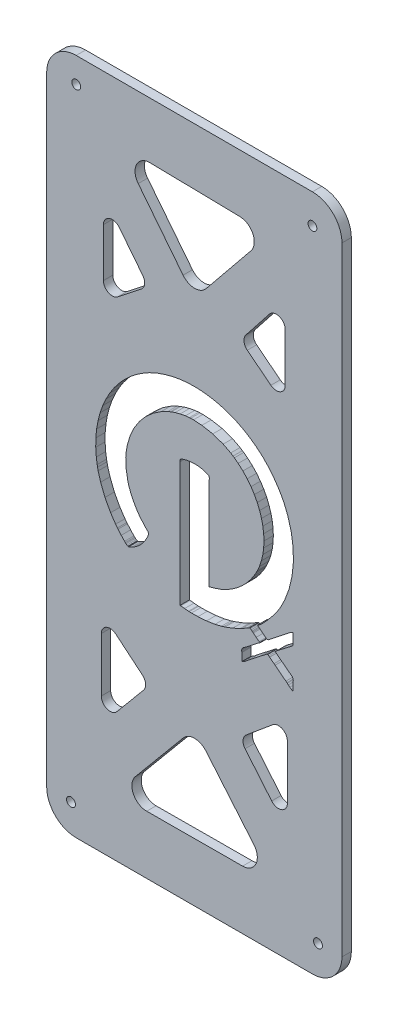
from build123d import *

# Parameters (mm, degrees)
SKETCH1_R            = 1.5
BOSS_EXTRUDE1_DEPTH  = 3.175
FILLET1_R            = 10
CUT_EXTRUDE1_DEPTH   = 10
CUT_EXTRUDE2_DEPTH   = 422.202335286
FILLET2_R            = 5
CUT_EXTRUDE3_DEPTH   = 10
FILLET3_R            = 3
FILLET3_OF_MIRROR1_R = 3


with BuildPart() as part:
    # Sketch1 → Boss-Extrude1 (new body)
    with BuildSketch(Plane.XY):
        Polygon((265, -210.189762894), (365, -210.108681785), (365, 19.292893219), (265, 19.292893219), align=None)
        with Locations((273.244250911, -200.546907154)):
            Circle(SKETCH1_R, mode=Mode.SUBTRACT)
        with Locations((356.893580541, -200.189762894)):
            Circle(SKETCH1_R, mode=Mode.SUBTRACT)
        with Locations((355, 9.292893219)):
            Circle(SKETCH1_R, mode=Mode.SUBTRACT)
        with Locations((275, 10.782163294)):
            Circle(SKETCH1_R, mode=Mode.SUBTRACT)
    extrude(amount=BOSS_EXTRUDE1_DEPTH)

    # Fillet1
    fillet1_edges = [part.edges().sort_by_distance(p)[0] for p in [
        (365, -210.108681785, 1.5875),
        (265, -210.189762894, 1.5875),
        (265, 19.292893219, 1.5875),
        (365, 19.292893219, 1.5875),
    ]]
    fillet(fillet1_edges, radius=FILLET1_R)

    # Sketch4 → Cut-Extrude1 (cut)
    with BuildSketch(Plane.XY.offset(3.175)):
        Polygon((320.437053308, -113.928378238), (320.057005808, -114.057638838), (320.057005808, -82.630688738), (320.075319208, -82.250641238), (320.049716008, -81.827566138), (320.027579908, -81.751378838), (320.014067108, -81.703106138), (319.931567908, -81.570022838), (319.780171208, -81.439784338), (319.598281808, -81.343327838), (319.456041808, -81.282075738), (319.408747008, -81.261806538), (319.281442208, -81.206421838), (317.969100408, -80.769833938), (317.834505808, -80.734629538), (317.492952008, -80.644484938), (316.442065108, -80.475219338), (315.008108108, -80.404188238), (313.575217908, -80.509445838), (312.528064808, -80.690801838), (312.185622008, -80.778546138), (312.069429708, -80.807972038), (311.718274708, -80.894293938), (311.186297108, -81.046757438), (310.681789608, -81.251671938), (310.376062508, -81.441206738), (310.296941508, -81.525572838), (310.260759208, -81.564244338), (310.187416708, -81.713774138), (310.145900408, -81.935135138), (310.143055608, -82.167608638), (310.148389608, -82.332073638), (310.148389608, -124.429335138), (310.411711408, -124.431290938), (311.722630808, -124.560996038), (313.033994708, -124.698968838), (313.296872008, -124.705636338), (314.029585808, -124.723594138), (316.229327408, -124.693190338), (319.143558308, -124.484275338), (322.028718908, -124.039153038), (324.173075808, -123.532689738), (324.872452108, -123.315595938), (325.402029408, -123.150775338), (327.984307708, -122.188966238), (330.491910008, -121.047756938), (330.984327108, -120.793680738), (331.142480208, -120.712248338), (332.684895208, -119.817025338), (332.836380808, -119.723947038), (332.896655008, -119.686786838), (333.233319308, -119.452802038), (333.596475808, -119.284958838), (333.669818308, -119.281136138), (333.743694208, -119.276868938), (333.969855808, -119.347188838), (334.265981708, -119.530411738), (334.542282908, -119.760129338), (334.719371708, -119.916326638), (334.781068308, -119.965043838), (334.972558908, -120.114573638), (335.945391608, -120.916184938), (336.971208708, -121.635297038), (337.188747008, -121.743843938), (337.188747008, -121.929022638), (337.073088108, -121.977828738), (336.742202308, -122.166296738), (336.321171908, -122.464378438), (335.917388108, -122.790819238), (335.622240108, -123.034494138), (335.521872008, -123.113615138), (332.651202108, -125.355406438), (332.557057008, -125.429193438), (332.259064208, -125.631174238), (331.809585808, -125.941346338), (331.401001408, -126.286278338), (331.176262208, -126.562579538), (331.132879008, -126.667748238), (331.106297908, -126.732823038), (331.065315008, -126.945560738), (331.052780108, -127.253777038), (331.066292908, -127.565816038), (331.076872008, -127.782820938), (331.076872008, -130.448576338), (331.274674508, -130.397014338), (332.201634808, -129.818275338), (333.049118508, -129.092406838), (333.206827108, -128.967413438), (333.559315608, -128.687645138), (337.113093108, -125.929789338), (337.466559508, -125.652421338), (337.597864808, -125.549208438), (338.908784208, -124.519479738), (339.040889608, -124.418222638), (339.082850408, -124.386396438), (339.203843308, -124.286117238), (339.383776908, -124.149033438), (339.577756708, -124.043509138), (339.731553708, -124.004926538), (339.781693308, -124.007326838), (339.850679708, -124.010616138), (340.179165208, -124.173214238), (340.471912908, -124.408621438), (340.522497008, -124.448626438), (342.004193308, -125.600859338), (342.368327708, -125.882583438), (345.992958508, -128.717515538), (346.356559508, -128.999328538), (346.482530808, -129.096229538), (346.845687308, -129.405868238), (347.362640808, -129.837033238), (347.909109108, -130.211302238), (348.336984808, -130.412927438), (348.486514608, -130.448576338), (348.486514608, -127.874476838), (348.496649208, -127.653115838), (348.508739608, -127.340098938), (348.495582408, -127.030015738), (348.456110808, -126.812921938), (348.430596508, -126.745891338), (348.387124408, -126.630588038), (348.152250608, -126.324860938), (347.722596908, -125.949169538), (347.244137108, -125.614905538), (346.921874608, -125.395855938), (346.819639608, -125.316379338), (346.580409708, -125.129689338), (344.188999708, -123.258344338), (343.948880808, -123.072632238), (343.822109408, -122.974219938), (343.186296608, -122.462956038), (342.518302008, -122.002365138), (342.374639608, -121.929022638), (342.448426608, -121.832566138), (342.701169308, -121.567733038), (343.072949108, -121.246626238), (343.466064908, -120.947033238), (343.760323908, -120.727183538), (343.856247008, -120.651796338), (344.102233308, -120.458972238), (346.573653308, -118.548511238), (346.819639608, -118.356487238), (346.918496408, -118.279322038), (347.227690608, -118.066673238), (347.678146908, -117.752678438), (348.091976408, -117.405879538), (348.335473508, -117.124244338), (348.391391608, -117.017653238), (348.425262508, -116.953467438), (348.481180608, -116.739396238), (348.505717008, -116.428690738), (348.496649208, -116.112829038), (348.486514608, -115.891023538), (348.486514608, -113.224201338), (348.337962708, -113.246426338), (347.908131208, -113.426804438), (347.355973308, -113.792805738), (346.836530608, -114.226904438), (346.480041608, -114.535654138), (346.356559508, -114.633088538), (345.994292008, -114.918101938), (342.365482908, -117.770013938), (342.004193308, -118.057961038), (341.874399308, -118.161173938), (340.561524108, -119.180768038), (340.429952108, -119.282558538), (340.388969208, -119.314384738), (340.267887408, -119.414219438), (340.089376208, -119.547391638), (339.896552108, -119.641981238), (339.739199108, -119.668028938), (339.689059508, -119.660205738), (339.618739608, -119.649093238), (339.416136508, -119.556014938), (339.149436508, -119.367458038), (338.897671708, -119.148408438), (338.729739608, -118.999856538), (338.670443308, -118.954606438), (338.476107908, -118.804543238), (336.541021608, -117.274752038), (336.355309508, -117.113576338), (336.579159708, -116.997917438), (337.202704308, -116.560440538), (338.000937408, -115.858663938), (338.744763708, -115.089234438), (339.256916608, -114.523563738), (339.427249008, -114.335451338), (339.804451708, -113.918777038), (341.594719908, -111.788377438), (343.227279508, -109.535029138), (343.524916708, -109.057013838), (344.098410608, -108.136809938), (345.570950208, -105.223112438), (347.093096008, -101.169805838), (348.086642408, -96.962079938), (348.546255408, -92.666076338), (348.467223308, -88.346514238), (347.843589808, -84.069357438), (346.671087708, -79.900214138), (345.441689608, -76.869435338), (344.943405108, -75.904781438), (344.602918108, -75.243898838), (343.466064908, -73.320991838), (341.765407908, -70.867440738), (339.854057908, -68.575065338), (338.295729808, -66.973265138), (337.744372008, -66.475069538), (337.273202008, -66.048171738), (335.792928108, -64.841354238), (333.737382308, -63.373793038), (331.589024908, -62.073363838), (329.359412908, -60.941933538), (327.059747708, -59.980657838), (324.700697308, -59.191136938), (322.293463108, -58.575237738), (319.850046608, -58.134916038), (317.381649208, -57.871051948), (314.898672208, -57.786170228), (312.412850408, -57.880697598), (309.935118508, -58.157585538), (307.477300208, -58.617198538), (305.049796808, -59.261545738), (302.664876508, -60.092582938), (300.904834308, -60.834897938), (300.332318308, -61.112177038), (299.701483908, -61.417548538), (297.861876208, -62.444343538), (295.539630408, -63.971823338), (293.373048508, -65.679770138), (291.367642308, -67.553959938), (289.530434908, -69.580613238), (287.867382608, -71.744883738), (286.385241808, -74.033436438), (285.090253288, -76.430980538), (283.988648938, -78.924003238), (283.087202938, -81.498191638), (282.392182738, -84.139232838), (281.910362518, -86.832991738), (281.647022938, -89.565866638), (281.609880518, -92.322211138), (281.804731538, -95.089223638), (282.099906208, -97.167083338), (282.237363388, -97.851968938), (282.436081558, -98.837247638), (283.266149748, -101.747122438), (284.743952228, -105.478344338), (286.654431008, -109.007941038), (288.351176408, -111.513054138), (288.979166008, -112.298218938), (289.183636008, -112.553806438), (290.250524908, -113.824187438), (291.387822608, -115.030027038), (291.627497008, -115.253343838), (291.692127308, -115.313173538), (291.882284408, -115.495863038), (292.170142608, -115.734648438), (292.487515608, -115.896268638), (292.751370808, -115.928005938), (292.831380808, -115.908803538), (292.983755408, -115.871198838), (293.740472208, -115.547513938), (294.458250808, -115.137596038), (294.590889608, -115.057586038), (294.902039608, -114.869384738), (295.785616708, -114.223081738), (296.858195208, -113.242959238), (297.795823508, -112.133220538), (298.408344508, -111.226440538), (298.585433308, -110.909156438), (298.656286608, -110.782296138), (298.870891208, -110.403137638), (299.183374708, -109.790616638), (299.415937108, -109.157826438), (299.483945608, -108.729061738), (299.460742708, -108.594022638), (299.447229908, -108.510545538), (299.332904508, -108.273715938), (299.101942308, -107.983457438), (298.828397008, -107.720580138), (298.634595008, -107.544024738), (298.572809508, -107.482772638), (298.390475608, -107.299994238), (296.703331408, -105.373620138), (296.547667508, -105.167638838), (296.216248308, -104.728739538), (295.298355808, -103.352745338), (294.211820008, -101.420503838), (293.315174608, -99.393850538), (292.776440608, -97.828321538), (292.635534108, -97.296343938), (292.473558308, -96.681422638), (291.919266808, -93.531873438), (291.777560208, -90.339385538), (291.820854508, -89.702772638), (291.878283908, -88.863023238), (292.298958708, -86.360843838), (293.243254508, -83.164088738), (294.621204508, -80.152956838), (296.398137708, -77.367630938), (298.539472008, -74.850427438), (301.012403308, -72.640906838), (303.782260608, -70.781118838), (306.034719908, -69.623107438), (306.814639608, -69.311601838), (307.225979908, -69.147136838), (308.482937008, -68.711971338), (310.221198708, -68.231555738), (311.992264508, -67.902270138), (313.317674608, -67.767675538), (313.759952108, -67.757096438), (314.710559808, -67.733360138), (317.568783708, -67.910448938), (321.241598308, -68.585199938), (324.761949408, -69.819932038), (327.318268908, -71.129340138), (328.113568308, -71.652249938), (328.564469108, -71.948375838), (329.859119808, -72.923519938), (331.458430808, -74.341119338), (332.907767508, -75.889846238), (334.202329308, -77.556187838), (335.338649108, -79.325831238), (336.311837408, -81.184641338), (337.117893708, -83.118216338), (337.752195208, -85.112598938), (338.211274808, -87.153298438), (338.490065208, -89.226802038), (338.584654808, -91.318530138), (338.491043108, -93.414703238), (338.204607308, -95.500208338), (337.721346908, -97.562066038), (337.036372408, -99.585341138), (336.392469708, -101.075216238), (336.146038908, -101.556076338), (335.913565408, -102.010444238), (335.136579408, -103.333898538), (333.986302308, -105.009041238), (332.703742008, -106.575014738), (331.297344008, -108.025773838), (329.775109308, -109.354651038), (328.144950008, -110.555156638), (326.415311608, -111.621601038), (325.058608708, -112.334845738), (324.594639608, -112.547583438), (324.226149108, -112.716404538), (322.343247108, -113.362174138), align=None)
    extrude(amount=-CUT_EXTRUDE1_DEPTH, mode=Mode.SUBTRACT)

    # Sketch5 → Cut-Extrude2 (cut, through all)
    with BuildSketch(Plane.XY.offset(3.175)):
        Polygon((340.653465394, -0.441766077), (289.462823992, 0.511192553), (315.058144693, -31.959437638), align=None)
        Polygon((288.141634637, -190.483211015), (342.023590735, -190.253159783), (315.082612686, -158.161139427), align=None)
    extrude(amount=-CUT_EXTRUDE2_DEPTH, mode=Mode.SUBTRACT)

    # Fillet2
    fillet2_edges = [part.edges().sort_by_distance(p)[0] for p in [
        (288.141634637, -190.483211015, 1.5875),
        (315.082612686, -158.161139427, 1.5875),
        (342.023590735, -190.253159783, 1.5875),
        (289.462823992, 0.511192553, 1.5875),
        (315.058144693, -31.959437638, 1.5875),
        (340.653465394, -0.441766077, 1.5875),
    ]]
    fillet(fillet2_edges, radius=FILLET2_R)

    # Sketch6 → Cut-Extrude3 (cut)
    with BuildSketch(Plane.XY.offset(3.175)):
        Polygon((299.40937221, -36.337548586), (284.218037767, -17.065580534), (284.218037767, -48.312280048), align=None)
        Polygon((283.493471738, -139.612458879), (283.493471738, -172.632069729), (299.733267625, -153.148595735), align=None)
    cut_extrude3 = extrude(amount=-CUT_EXTRUDE3_DEPTH, mode=Mode.SUBTRACT)

    # Fillet3
    fillet3_edges = [part.edges().sort_by_distance(p)[0] for p in [
        (283.493471738, -172.632069729, 1.5875),
        (283.493471738, -139.612458879, 1.5875),
        (299.733267625, -153.148595735, 1.5875),
        (284.218037767, -48.312280048, 1.5875),
        (284.218037767, -17.065580534, 1.5875),
        (299.40937221, -36.337548586, 1.5875),
    ]]
    fillet(fillet3_edges, radius=FILLET3_R)

    # Mirror1: Cut-Extrude3 across plane
    add(cut_extrude3.mirror(Plane(origin=(315, 0, 0), x_dir=(0, 0, 1), z_dir=(1, 0, 0))), mode=Mode.SUBTRACT)

    # Fillet3 of Mirror1
    fillet3_of_mirror1_edges = [part.edges().sort_by_distance(p)[0] for p in [
        (346.506528262, -172.632069729, 1.5875),
        (346.506528262, -139.612458879, 1.5875),
        (330.266732375, -153.148595735, 1.5875),
        (345.781962233, -48.312280048, 1.5875),
        (345.781962233, -17.065580534, 1.5875),
        (330.59062779, -36.337548586, 1.5875),
    ]]
    fillet(fillet3_of_mirror1_edges, radius=FILLET3_OF_MIRROR1_R)


solid = part.part
